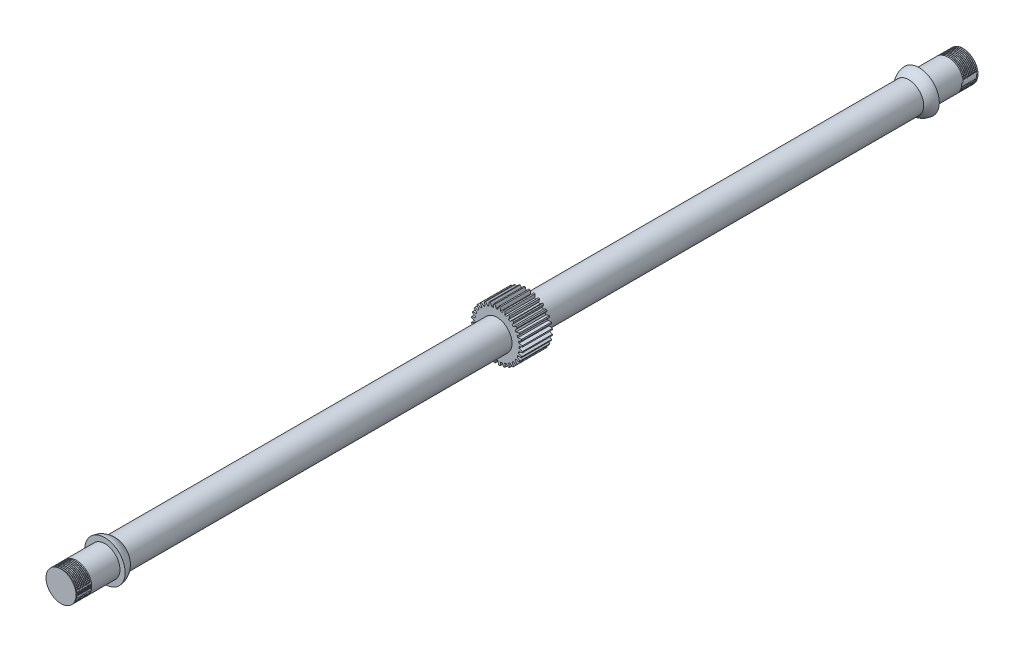
from build123d import *

# Parameters (mm, degrees)
SKETCH1_R                                = 12.7
BOSS_EXTRUDE1_DEPTH                      = 381
THREAD1_PITCH                            = 1.27
THREAD2_PITCH                            = 1.27
INCH_START                               = 72.658053689
INCH_SPUR_GEAR_20DP_32T_14_5PA_1FW_OUT_R = 0.396875
INCH_SPUR_GEAR_20DP_32T_14_5PA_1FW_DEPTH = 25.4
BODY_MOVE_COPY1_ANGLE                    = 90


with BuildPart() as part:
    # Sketch1 → Boss-Extrude1 (new, symmetric)
    with BuildSketch(Plane.XY):
        Circle(SKETCH1_R)
    extrude(amount=BOSS_EXTRUDE1_DEPTH, both=True)

    # Thread1: arcs per turn and ends read off the stored shape
    # Thread1: the profile of Thread Profile1 profile screwed along a right-hand helix through 10 turns, 8 arcs to a turn; built about Z, then put on its axis
    thread1_z = Axis((0, 0, 0), (0, 0, 1))
    thread1_corners = [(12.7003, 0, -0.000173205), (12.7003, 0, 1.111423202), (12.012592339, 0, 0.714374998), (12.012592339, 0, 0.396874998)]
    with BuildLine(mode=Mode.PRIVATE) as thread1_profile:
        Line(thread1_corners[0], thread1_corners[1])
        Line(thread1_corners[1], thread1_corners[2])
        Line(thread1_corners[2], thread1_corners[3])
        Line(thread1_corners[3], thread1_corners[0])
    thread1_cap = Face(thread1_profile.wire())
    thread1_turn_angles = [0, 22.5, 45, 67.5, 90, 112.5, 135, 157.5, 180, 202.5, 225, 247.5, 270, 292.5, 315, 337.5, 360]
    thread1_turn_weights = [1, 0.9238795325112867, 1, 0.9238795325112867, 1, 0.9238795325112867, 1, 0.9238795325112867, 1, 0.9238795325112867, 1, 0.9238795325112867, 1, 0.9238795325112867, 1, 0.9238795325112867, 1]
    thread1_turn_rails = [Edge.make_bspline([Vector(p[0], p[1], 0).rotate(thread1_z, thread1_turn_angles[k]) / thread1_turn_weights[k] + Vector(0, 0, p[2] + THREAD1_PITCH * thread1_turn_angles[k] / 360) for k in range(17)], [0, 0, 0, 1, 1, 2, 2, 3, 3, 4, 4, 5, 5, 6, 6, 7, 7, 8, 8, 8], 2, thread1_turn_weights) for p in thread1_corners]
    thread1_turn_sides = [Face.make_surface_from_curves(thread1_turn_rails[p[0]], thread1_turn_rails[p[1]]) for p in [(0, 1), (1, 2), (2, 3), (3, 0)]]
    thread1 = Plane(origin=(0, 0, 381), x_dir=(-1, 0, 0), z_dir=(0, 0, -1)) * Solid(Shell([*[p.moved(Location((0, 0, THREAD1_PITCH * i))) for i in range(10) for p in thread1_turn_sides], thread1_cap, thread1_cap.rotate(thread1_z, 3600).moved(Location((0, 0, THREAD1_PITCH * 3600 / 360)))]))
    add(thread1, mode=Mode.SUBTRACT)

    # Thread2: arcs per turn and ends read off the stored shape
    # Thread2: the profile of Thread Profile2 profile screwed along a right-hand helix through 10 turns, 8 arcs to a turn; built about Z, then put on its axis
    thread2_z = Axis((0, 0, 0), (0, 0, 1))
    thread2_corners = [(12.7003, 0, -0.000173205), (12.7003, 0, 1.111423202), (12.012592339, 0, 0.714374998), (12.012592339, 0, 0.396874998)]
    with BuildLine(mode=Mode.PRIVATE) as thread2_profile:
        Line(thread2_corners[0], thread2_corners[1])
        Line(thread2_corners[1], thread2_corners[2])
        Line(thread2_corners[2], thread2_corners[3])
        Line(thread2_corners[3], thread2_corners[0])
    thread2_cap = Face(thread2_profile.wire())
    thread2_turn_angles = [0, 22.5, 45, 67.5, 90, 112.5, 135, 157.5, 180, 202.5, 225, 247.5, 270, 292.5, 315, 337.5, 360]
    thread2_turn_weights = [1, 0.9238795325112867, 1, 0.9238795325112867, 1, 0.9238795325112867, 1, 0.9238795325112867, 1, 0.9238795325112867, 1, 0.9238795325112867, 1, 0.9238795325112867, 1, 0.9238795325112867, 1]
    thread2_turn_rails = [Edge.make_bspline([Vector(p[0], p[1], 0).rotate(thread2_z, thread2_turn_angles[k]) / thread2_turn_weights[k] + Vector(0, 0, p[2] + THREAD2_PITCH * thread2_turn_angles[k] / 360) for k in range(17)], [0, 0, 0, 1, 1, 2, 2, 3, 3, 4, 4, 5, 5, 6, 6, 7, 7, 8, 8, 8], 2, thread2_turn_weights) for p in thread2_corners]
    thread2_turn_sides = [Face.make_surface_from_curves(thread2_turn_rails[p[0]], thread2_turn_rails[p[1]]) for p in [(0, 1), (1, 2), (2, 3), (3, 0)]]
    thread2 = Plane(origin=(0, 0, -381), x_dir=(1, 0, 0), z_dir=(0, 0, 1)) * Solid(Shell([*[p.moved(Location((0, 0, THREAD2_PITCH * i))) for i in range(10) for p in thread2_turn_sides], thread2_cap, thread2_cap.rotate(thread2_z, 3600).moved(Location((0, 0, THREAD2_PITCH * 3600 / 360)))]))
    add(thread2, mode=Mode.SUBTRACT)

    # Sketch11 → Revolve1 (revolve)
    with BuildSketch(Plane(origin=(0, 0, 0), x_dir=(1, 0, 0), z_dir=(0, 1, 0))):
        with BuildLine():
            Line((17.096155381, 343.920099216), (12.7, 343.920099216))
            Line((12.7, 343.920099216), (12.7, 335.127788453))
            ThreePointArc((12.7, 335.127788453), (15.80044797, 339.072758694), (17.096155381, 343.920099216))
        make_face()
    revolve1 = revolve(axis=Axis((0, 0, 0), (0, 0, -1)))

    # Mirror1: Revolve1 across plane
    add(revolve1.mirror(Plane.XY))


with BuildPart() as body_2:
    # Inch - Spur gear 20DP 32T 14.5PA 1FW: read off the stored shape, not the designer's step
    # Inch - Spur gear 20DP 32T 14.5PA 1FW out → Inch - Spur gear 20DP 32T 14.5PA 1FW (new body)
    with BuildSketch(Plane.YZ.offset(INCH_START)):
        with BuildLine():
            ThreePointArc((3.139807132, 1.986016715), (2.661409781, 2.038524779), (2.181960886, 2.080356336))
            ThreePointArc((2.181960886, 2.080356336), (1.59074941, 0.724644761), (1.254995302, -0.7157559))
            ThreePointArc((1.254995302, -0.7157559), (0.545219721, -0.70231347), (-0.16455586, -0.7157559))
            ThreePointArc((-0.16455586, -0.7157559), (-0.500309967, 0.724644761), (-1.091521443, 2.080356336))
            ThreePointArc((-1.091521443, 2.080356336), (-1.570970338, 2.038524779), (-2.049367689, 1.986016715))
            ThreePointArc((-2.049367689, 1.986016715), (-2.364732995, 0.541015121), (-2.413027453, -0.937211022))
            ThreePointArc((-2.413027453, -0.937211022), (-3.111787383, -1.062497232), (-3.805302337, -1.214151716))
            ThreePointArc((-3.805302337, -1.214151716), (-4.415613252, 0.133069673), (-5.259950973, 1.347391993))
            ThreePointArc((-5.259950973, 1.347391993), (-5.72202646, 1.212828379), (-6.180987725, 1.067998549))
            ThreePointArc((-6.180987725, 1.067998549), (-6.208387548, -0.410762464), (-5.967366428, -1.870006687))
            ThreePointArc((-5.967366428, -1.870006687), (-6.628257755, -2.129206857), (-7.278860692, -2.413245398))
            ThreePointArc((-7.278860692, -2.413245398), (-8.140274509, -1.210976244), (-9.205291049, -0.184708905))
            ThreePointArc((-9.205291049, -0.184708905), (-9.632235827, -0.406833372), (-10.054123381, -0.638419239))
            ThreePointArc((-10.054123381, -0.638419239), (-9.792504762, -2.094111714), (-9.27143037, -3.47829608))
            ThreePointArc((-9.27143037, -3.47829608), (-9.869055411, -3.861449293), (-10.451744024, -4.26695645))
            ThreePointArc((-10.451744024, -4.26695645), (-11.531157092, -3.255842059), (-12.775924464, -2.457068579))
            ThreePointArc((-12.775924464, -2.457068579), (-13.151331283, -2.758217782), (-13.519932226, -3.067659969))
            ThreePointArc((-13.519932226, -3.067659969), (-12.979349022, -4.444342461), (-12.198245954, -5.700273542))
            ThreePointArc((-12.198245954, -5.700273542), (-12.709638313, -6.192655435), (-13.202020206, -6.704047795))
            ThreePointArc((-13.202020206, -6.704047795), (-14.457951287, -5.922944727), (-15.834633779, -5.382361522))
            ThreePointArc((-15.834633779, -5.382361522), (-16.144075967, -5.750962464), (-16.445225169, -6.126369284))
            ThreePointArc((-16.445225169, -6.126369284), (-15.646451689, -7.371136656), (-14.635337298, -8.450549725))
            ThreePointArc((-14.635337298, -8.450549725), (-15.040844455, -9.033238338), (-15.423997668, -9.630863379))
            ThreePointArc((-15.423997668, -9.630863379), (-16.808182035, -9.109788986), (-18.26387451, -8.848170367))
            ThreePointArc((-18.26387451, -8.848170367), (-18.495460376, -9.270057922), (-18.717584844, -9.697002699))
            ThreePointArc((-18.717584844, -9.697002699), (-17.691317504, -10.76201924), (-16.48904835, -11.623433057))
            ThreePointArc((-16.48904835, -11.623433057), (-16.773086891, -12.274035993), (-17.032287061, -12.93492732))
            ThreePointArc((-17.032287061, -12.93492732), (-18.491531284, -12.6939062), (-19.970292297, -12.721306023))
            ThreePointArc((-19.970292297, -12.721306023), (-20.115122127, -13.180267288), (-20.249685741, -13.642342775))
            ThreePointArc((-20.249685741, -13.642342775), (-19.035363421, -14.486680496), (-17.688142033, -15.096991411))
            ThreePointArc((-17.688142033, -15.096991411), (-17.839796517, -15.790506365), (-17.965082726, -16.489266296))
            ThreePointArc((-17.965082726, -16.489266296), (-19.443308869, -16.537560754), (-20.888310463, -16.852926059))
            ThreePointArc((-20.888310463, -16.852926059), (-20.940818527, -17.33132341), (-20.982650084, -17.810772305))
            ThreePointArc((-20.982650084, -17.810772305), (-19.626938509, -18.401983781), (-18.186537849, -18.737737889))
            ThreePointArc((-18.186537849, -18.737737889), (-18.199980279, -19.44751347), (-18.186537849, -20.157289051))
            ThreePointArc((-18.186537849, -20.157289051), (-19.626938509, -20.493043159), (-20.982650084, -21.084254634))
            ThreePointArc((-20.982650084, -21.084254634), (-20.940818527, -21.563703529), (-20.888310463, -22.04210088))
            ThreePointArc((-20.888310463, -22.04210088), (-19.443308869, -22.357466186), (-17.965082726, -22.405760644))
            ThreePointArc((-17.965082726, -22.405760644), (-17.839796517, -23.104520574), (-17.688142033, -23.798035528))
            ThreePointArc((-17.688142033, -23.798035528), (-19.035363421, -24.408346444), (-20.249685741, -25.252684165))
            ThreePointArc((-20.249685741, -25.252684165), (-20.115122127, -25.714759652), (-19.970292297, -26.173720916))
            ThreePointArc((-19.970292297, -26.173720916), (-18.491531284, -26.20112074), (-17.032287061, -25.960099619))
            ThreePointArc((-17.032287061, -25.960099619), (-16.773086891, -26.620990946), (-16.48904835, -27.271593883))
            ThreePointArc((-16.48904835, -27.271593883), (-17.691317504, -28.1330077), (-18.717584844, -29.19802424))
            ThreePointArc((-18.717584844, -29.19802424), (-18.495460376, -29.624969017), (-18.26387451, -30.046856572))
            ThreePointArc((-18.26387451, -30.046856572), (-16.808182035, -29.785237953), (-15.423997668, -29.264163561))
            ThreePointArc((-15.423997668, -29.264163561), (-15.040844455, -29.861788602), (-14.635337298, -30.444477215))
            ThreePointArc((-14.635337298, -30.444477215), (-15.646451689, -31.523890283), (-16.445225169, -32.768657656))
            ThreePointArc((-16.445225169, -32.768657656), (-16.144075967, -33.144064475), (-15.834633779, -33.512665417))
            ThreePointArc((-15.834633779, -33.512665417), (-14.457951287, -32.972082213), (-13.202020206, -32.190979145))
            ThreePointArc((-13.202020206, -32.190979145), (-12.709638313, -32.702371504), (-12.198245954, -33.194753397))
            ThreePointArc((-12.198245954, -33.194753397), (-12.979349022, -34.450684478), (-13.519932226, -35.82736697))
            ThreePointArc((-13.519932226, -35.82736697), (-13.151331284, -36.136809158), (-12.775924464, -36.43795836))
            ThreePointArc((-12.775924464, -36.43795836), (-11.531157092, -35.63918488), (-10.451744024, -34.628070489))
            ThreePointArc((-10.451744024, -34.628070489), (-9.869055411, -35.033577646), (-9.27143037, -35.416730859))
            ThreePointArc((-9.27143037, -35.416730859), (-9.792504762, -36.800915226), (-10.054123381, -38.256607701))
            ThreePointArc((-10.054123381, -38.256607701), (-9.632235826, -38.488193567), (-9.205291049, -38.710318035))
            ThreePointArc((-9.205291049, -38.710318035), (-8.140274509, -37.684050696), (-7.278860692, -36.481781541))
            ThreePointArc((-7.278860692, -36.481781541), (-6.628257755, -36.765820083), (-5.967366428, -37.025020252))
            ThreePointArc((-5.967366428, -37.025020252), (-6.208387548, -38.484264475), (-6.180987725, -39.963025488))
            ThreePointArc((-6.180987725, -39.963025488), (-5.72202646, -40.107855318), (-5.259950973, -40.242418932))
            ThreePointArc((-5.259950973, -40.242418932), (-4.415613252, -39.028096613), (-3.805302337, -37.680875224))
            ThreePointArc((-3.805302337, -37.680875224), (-3.111787383, -37.832529708), (-2.413027453, -37.957815917))
            ThreePointArc((-2.413027453, -37.957815917), (-2.364732995, -39.43604206), (-2.049367689, -40.881043654))
            ThreePointArc((-2.049367689, -40.881043654), (-1.570970338, -40.933551719), (-1.091521443, -40.975383275))
            ThreePointArc((-1.091521443, -40.975383275), (-0.500309967, -39.6196717), (-0.16455586, -38.17927104))
            ThreePointArc((-0.16455586, -38.17927104), (0.545219721, -38.19271347), (1.254995302, -38.17927104))
            ThreePointArc((1.254995302, -38.17927104), (1.59074941, -39.6196717), (2.181960886, -40.975383275))
            ThreePointArc((2.181960886, -40.975383275), (2.661409781, -40.933551719), (3.139807132, -40.881043654))
            ThreePointArc((3.139807132, -40.881043654), (3.455172437, -39.43604206), (3.503466896, -37.957815917))
            ThreePointArc((3.503466896, -37.957815917), (4.202226826, -37.832529708), (4.89574178, -37.680875224))
            ThreePointArc((4.89574178, -37.680875224), (5.506052695, -39.028096613), (6.350390416, -40.242418932))
            ThreePointArc((6.350390416, -40.242418932), (6.812465903, -40.107855318), (7.271427168, -39.963025488))
            ThreePointArc((7.271427168, -39.963025488), (7.298826991, -38.484264475), (7.057805871, -37.025020252))
            ThreePointArc((7.057805871, -37.025020252), (7.718697198, -36.765820083), (8.369300135, -36.481781541))
            ThreePointArc((8.369300135, -36.481781541), (9.230713951, -37.684050696), (10.295730492, -38.710318035))
            ThreePointArc((10.295730492, -38.710318035), (10.722675269, -38.488193567), (11.144562824, -38.256607701))
            ThreePointArc((11.144562824, -38.256607701), (10.882944205, -36.800915226), (10.361869812, -35.416730859))
            ThreePointArc((10.361869812, -35.416730859), (10.959494853, -35.033577646), (11.542183467, -34.628070489))
            ThreePointArc((11.542183467, -34.628070489), (12.621596535, -35.63918488), (13.866363907, -36.43795836))
            ThreePointArc((13.866363907, -36.43795836), (14.241770727, -36.136809158), (14.610371669, -35.82736697))
            ThreePointArc((14.610371669, -35.82736697), (14.069788465, -34.450684478), (13.288685396, -33.194753397))
            ThreePointArc((13.288685396, -33.194753397), (13.800077756, -32.702371504), (14.292459649, -32.190979145))
            ThreePointArc((14.292459649, -32.190979145), (15.54839073, -32.972082213), (16.925073222, -33.512665417))
            ThreePointArc((16.925073222, -33.512665417), (17.23451541, -33.144064475), (17.535664612, -32.768657656))
            ThreePointArc((17.535664612, -32.768657656), (16.736891132, -31.523890283), (15.725776741, -30.444477215))
            ThreePointArc((15.725776741, -30.444477215), (16.131283898, -29.861788602), (16.514437111, -29.264163561))
            ThreePointArc((16.514437111, -29.264163561), (17.898621478, -29.785237953), (19.354313953, -30.046856572))
            ThreePointArc((19.354313953, -30.046856572), (19.585899819, -29.624969018), (19.808024286, -29.19802424))
            ThreePointArc((19.808024286, -29.19802424), (18.781756947, -28.1330077), (17.579487793, -27.271593883))
            ThreePointArc((17.579487793, -27.271593883), (17.863526334, -26.620990946), (18.122726504, -25.960099619))
            ThreePointArc((18.122726504, -25.960099619), (19.581970727, -26.20112074), (21.06073174, -26.173720916))
            ThreePointArc((21.06073174, -26.173720916), (21.20556157, -25.714759652), (21.340125184, -25.252684165))
            ThreePointArc((21.340125184, -25.252684165), (20.125802864, -24.408346444), (18.778581476, -23.798035528))
            ThreePointArc((18.778581476, -23.798035528), (18.93023596, -23.104520574), (19.055522169, -22.405760644))
            ThreePointArc((19.055522169, -22.405760644), (20.533748312, -22.357466186), (21.978749906, -22.04210088))
            ThreePointArc((21.978749906, -22.04210088), (22.03125797, -21.563703529), (22.073089527, -21.084254634))
            ThreePointArc((22.073089527, -21.084254634), (20.717377952, -20.493043159), (19.276977292, -20.157289051))
            ThreePointArc((19.276977292, -20.157289051), (19.290419721, -19.44751347), (19.276977292, -18.737737889))
            ThreePointArc((19.276977292, -18.737737889), (20.717377952, -18.401983781), (22.073089527, -17.810772305))
            ThreePointArc((22.073089527, -17.810772305), (22.03125797, -17.33132341), (21.978749906, -16.852926059))
            ThreePointArc((21.978749906, -16.852926059), (20.533748312, -16.537560754), (19.055522169, -16.489266296))
            ThreePointArc((19.055522169, -16.489266296), (18.93023596, -15.790506365), (18.778581476, -15.096991411))
            ThreePointArc((18.778581476, -15.096991411), (20.125802864, -14.486680496), (21.340125184, -13.642342775))
            ThreePointArc((21.340125184, -13.642342775), (21.20556157, -13.180267288), (21.06073174, -12.721306023))
            ThreePointArc((21.06073174, -12.721306023), (19.581970727, -12.6939062), (18.122726504, -12.93492732))
            ThreePointArc((18.122726504, -12.93492732), (17.863526334, -12.274035993), (17.579487793, -11.623433057))
            ThreePointArc((17.579487793, -11.623433057), (18.781756947, -10.76201924), (19.808024286, -9.697002699))
            ThreePointArc((19.808024286, -9.697002699), (19.585899819, -9.270057922), (19.354313953, -8.848170367))
            ThreePointArc((19.354313953, -8.848170367), (17.898621478, -9.109788986), (16.514437111, -9.630863379))
            ThreePointArc((16.514437111, -9.630863379), (16.131283898, -9.033238338), (15.725776741, -8.450549725))
            ThreePointArc((15.725776741, -8.450549725), (16.736891132, -7.371136656), (17.535664612, -6.126369284))
            ThreePointArc((17.535664612, -6.126369284), (17.23451541, -5.750962464), (16.925073222, -5.382361522))
            ThreePointArc((16.925073222, -5.382361522), (15.54839073, -5.922944727), (14.292459649, -6.704047795))
            ThreePointArc((14.292459649, -6.704047795), (13.800077756, -6.192655435), (13.288685396, -5.700273542))
            ThreePointArc((13.288685396, -5.700273542), (14.069788465, -4.444342461), (14.610371669, -3.067659969))
            ThreePointArc((14.610371669, -3.067659969), (14.241770726, -2.758217782), (13.866363907, -2.457068579))
            ThreePointArc((13.866363907, -2.457068579), (12.621596535, -3.255842059), (11.542183467, -4.26695645))
            ThreePointArc((11.542183467, -4.26695645), (10.959494853, -3.861449293), (10.361869812, -3.47829608))
            ThreePointArc((10.361869812, -3.47829608), (10.882944205, -2.094111714), (11.144562824, -0.638419239))
            ThreePointArc((11.144562824, -0.638419239), (10.72267527, -0.406833372), (10.295730492, -0.184708905))
            ThreePointArc((10.295730492, -0.184708905), (9.230713951, -1.210976244), (8.369300135, -2.413245398))
            ThreePointArc((8.369300135, -2.413245398), (7.718697198, -2.129206857), (7.057805871, -1.870006687))
            ThreePointArc((7.057805871, -1.870006687), (7.298826991, -0.410762464), (7.271427168, 1.067998549))
            ThreePointArc((7.271427168, 1.067998549), (6.812465903, 1.212828379), (6.350390416, 1.347391993))
            ThreePointArc((6.350390416, 1.347391993), (5.506052695, 0.133069673), (4.89574178, -1.214151716))
            ThreePointArc((4.89574178, -1.214151716), (4.202226826, -1.062497232), (3.503466896, -0.937211022))
            ThreePointArc((3.503466896, -0.937211022), (3.455172437, 0.541015121), (3.139807132, 1.986016715))
        make_face()
        with Locations((0.545219721, -19.44751347)):
            Circle(INCH_SPUR_GEAR_20DP_32T_14_5PA_1FW_OUT_R, mode=Mode.SUBTRACT)
    extrude(amount=INCH_SPUR_GEAR_20DP_32T_14_5PA_1FW_DEPTH)


with BuildPart() as body_2_1:
    # Body-Move/Copy1: read off the stored shape, not the designer's step
    # Body-Move/Copy1: moved
    add(body_2.part.moved(Location((-117.5055672, -0.5452197, 19.4475135))).rotate(Axis((0, 0, 0), (0, -1, 0)), BODY_MOVE_COPY1_ANGLE))


with BuildPart() as body_2_2:
    # Body-Move/Copy2: read off the stored shape, not the designer's step
    # Body-Move/Copy2: moved
    add(body_2_1.part.moved(Location((0, 0, 32.1475135))))


with BuildPart() as part_1:
    add(part.part)

    # Combine1: union body 2
    add(body_2_2.part)


solid = part_1.part
